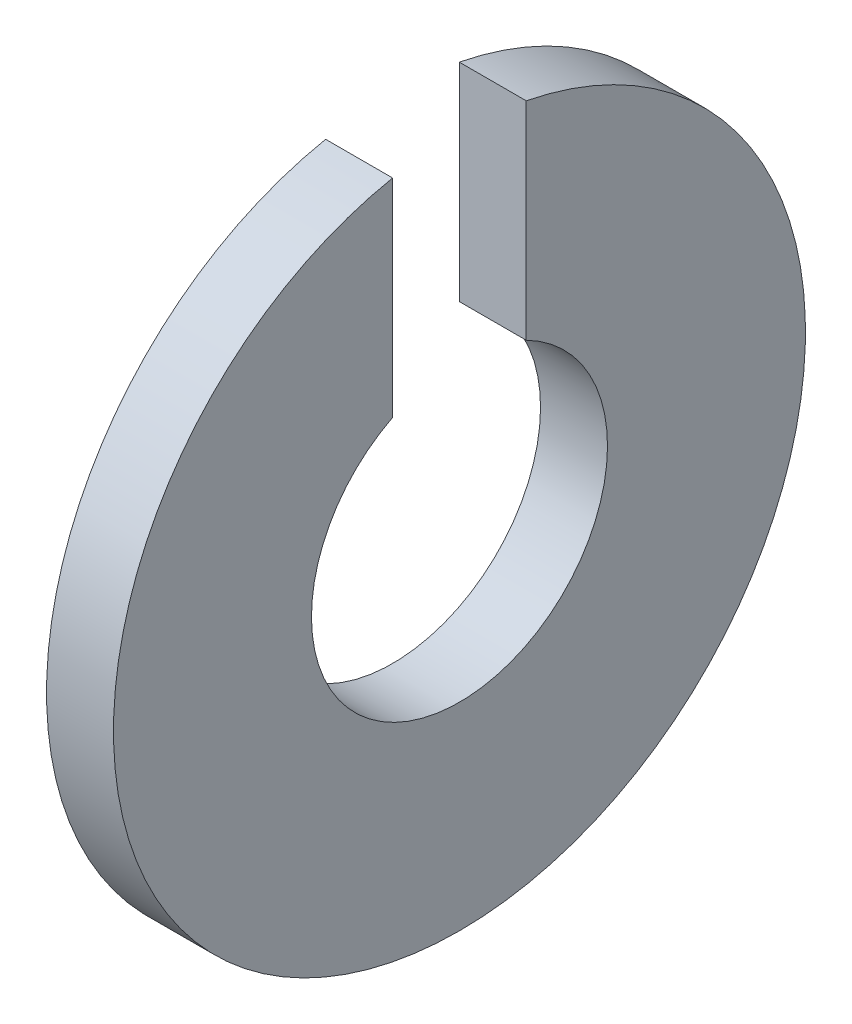
from build123d import *

# Parameters (mm, degrees)
BOSS_EXTRUDE1_DEPTH = 0.762


with BuildPart() as part:
    # Sketch1 → Boss-Extrude1 (new body)
    with BuildSketch(Plane(origin=(0, 0, 0), x_dir=(0, 0, -1), z_dir=(1, 0, 0))):
        with BuildLine():
            Line((0.75955472, 3.863035805), (0.75955472, 1.503285146))
            ThreePointArc((0.75955472, 1.503285146), (0.000760226, -1.684277003), (-0.760911474, 1.502598859))
            Line((-0.760911474, 1.502598859), (-0.760911474, 3.86276879))
            ThreePointArc((-0.760911474, 3.86276879), (0.00069139, -3.936999939), (0.75955472, 3.863035805))
        make_face()
    extrude(amount=BOSS_EXTRUDE1_DEPTH)


solid = part.part
